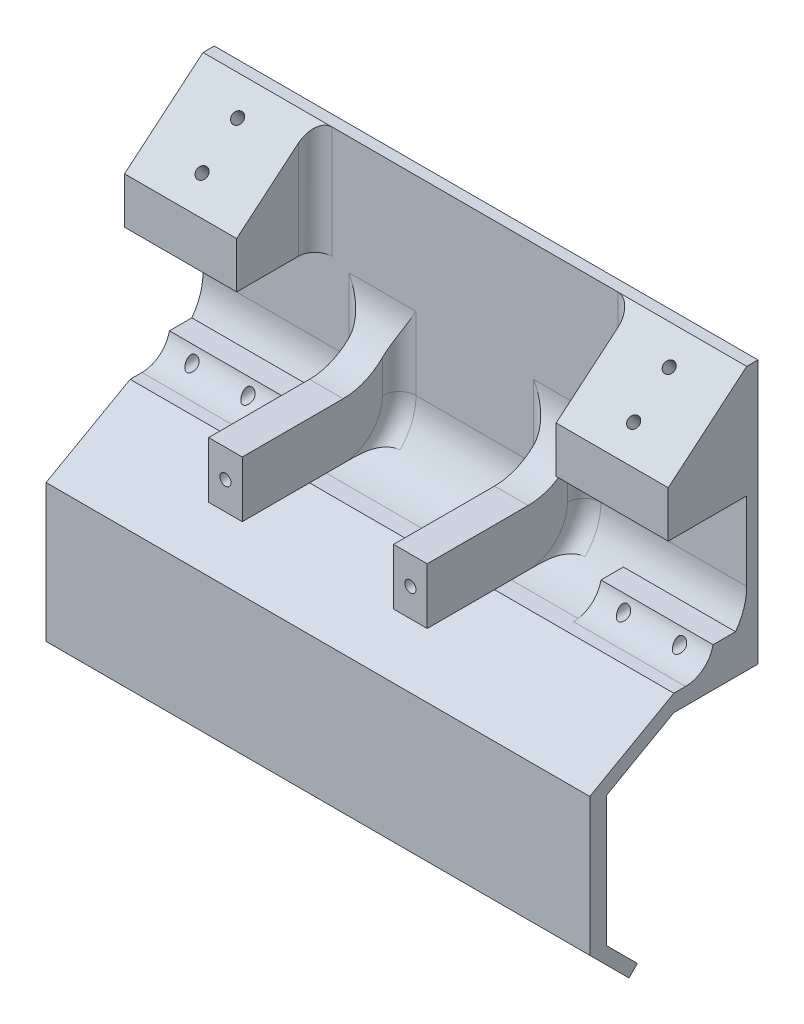
from build123d import *

# Parameters (mm, degrees)
SKETCH1_W            = 97
SKETCH1_H            = 47
BOSS_EXTRUDE1_DEPTH  = 2
SKETCH2_W            = 97
SKETCH2_H            = 20
BOSS_EXTRUDE2_DEPTH  = 20
CUT_EXTRUDE1_DEPTH   = 131
BOSS_EXTRUDE3_DEPTH  = 97
SKETCH6_W            = 57
SKETCH6_H            = 28.630146457
CUT_EXTRUDE3_DEPTH   = 82
SKETCH7_R            = 1
CUT_EXTRUDE4_DEPTH   = 82
SKETCH8_W            = 18.73898083
SKETCH8_H            = 25.042097397
CUT_EXTRUDE5_DEPTH   = 136
SKETCH9_R            = 1
CUT_EXTRUDE6_DEPTH   = 6
SKETCH11_W           = 97
SKETCH11_H           = 3
BOSS_EXTRUDE4_DEPTH  = 13
BOSS_EXTRUDE5_DEPTH  = 97
SKETCH13_W           = 3
SKETCH13_H           = 23.243678218
BOSS_EXTRUDE6_DEPTH  = 97
CUT_EXTRUDE7_START   = -97
SKETCH14_W           = 4.818553825
SKETCH14_H           = 10.461709092
CUT_EXTRUDE7_DEPTH   = 97
BOSS_EXTRUDE8_DEPTH  = 97
SKETCH16_W           = 6
SKETCH16_H           = 10
BOSS_EXTRUDE9_DEPTH  = 28
SKETCH17_R           = 1
CUT_EXTRUDE8_DEPTH   = 8
BOSS_EXTRUDE10_START = 6
SKETCH18_W           = 20
SKETCH18_H           = 4
SKETCH18_R           = 1
BOSS_EXTRUDE10_DEPTH = 6
FILLET1_R            = 5
FILLET2_R            = 10
FILLET3_R            = 3
FILLET4_R            = 3
FILLET5_R            = 3


# Some blends are built 0.0001 mm under size
with BuildPart() as part:
    # Sketch1 → Boss-Extrude1 (new body)
    with BuildSketch(Plane.XY):
        with Locations((48.5, 23.5)):
            Rectangle(SKETCH1_W, SKETCH1_H)
    extrude(amount=BOSS_EXTRUDE1_DEPTH)

    # Sketch2 → Boss-Extrude2 (add)
    with BuildSketch(Plane.XY.offset(2)):
        with Locations((48.5, 37)):
            Rectangle(SKETCH2_W, SKETCH2_H)
    extrude(amount=BOSS_EXTRUDE2_DEPTH)

    # Sketch3 → Cut-Extrude1 (cut)
    with BuildSketch(Plane.ZY):
        Polygon((2, 47), (24.809031761, 27.860949862), (24.941765114, 51.599681625), align=None)
    extrude(amount=-CUT_EXTRUDE1_DEPTH, mode=Mode.SUBTRACT)

    # Sketch4 → Boss-Extrude3 (add)
    with BuildSketch(Plane.ZY):
        Polygon((19.047930723, 32.695087618), (21.145957589, 30.934634049), (25.835071852, 27), (20.096944156, 27), align=None)
    extrude(amount=-BOSS_EXTRUDE3_DEPTH)

    # Sketch6 → Cut-Extrude3 (cut)
    with BuildSketch(Plane.XY.offset(2)):
        with Locations((48.5, 32.684926772)):
            Rectangle(SKETCH6_W, SKETCH6_H)
    extrude(amount=CUT_EXTRUDE3_DEPTH, mode=Mode.SUBTRACT)

    # Sketch7 → Cut-Extrude4 (cut)
    with BuildSketch(Plane.XY.offset(2)):
        with Locations(Location((15, 5, 0), (0, 0, 180))):
            Circle(SKETCH7_R)
        with Locations(Location((5, 5, 0), (0, 0, 180))):
            Circle(SKETCH7_R)
        with Locations((92, 5)):
            Circle(SKETCH7_R)
        with Locations((82, 5)):
            Circle(SKETCH7_R)
    extrude(amount=-CUT_EXTRUDE4_DEPTH, mode=Mode.SUBTRACT)

    # Sketch8 → Cut-Extrude5 (cut)
    with BuildSketch(Plane.ZY):
        with Locations((25.369490415, 39.521048699)):
            Rectangle(SKETCH8_W, SKETCH8_H)
    extrude(amount=-CUT_EXTRUDE5_DEPTH, mode=Mode.SUBTRACT)

    # Sketch9 → Cut-Extrude6 (cut)
    with BuildSketch(Plane(origin=(0, 28.565539928, 23.969334018), x_dir=(1, 0, 0), z_dir=(0, 0.7660444431189791, 0.642787609686538))):
        with Locations(Location((10, 23.678928769, 0), (0, 0, 270))):
            Circle(SKETCH9_R)
        with Locations(Location((10, 15.403226718, 0), (0, 0, 270))):
            Circle(SKETCH9_R)
        with Locations(Location((87, 15.403226718, 0), (0, 0, 270))):
            Circle(SKETCH9_R)
        with Locations(Location((87, 23.678928769, 0), (0, 0, 270))):
            Circle(SKETCH9_R)
    extrude(amount=-CUT_EXTRUDE6_DEPTH, mode=Mode.SUBTRACT)

    # Sketch11 → Boss-Extrude4 (add)
    with BuildSketch(Plane.XY.offset(2)):
        with Locations((48.5, 1.5)):
            Rectangle(SKETCH11_W, SKETCH11_H)
    extrude(amount=BOSS_EXTRUDE4_DEPTH)

    # Sketch12 → Boss-Extrude5 (add)
    with BuildSketch(Plane.ZY):
        Polygon((15, 0), (27, -6.756321782), (32.328343019, -6.756321782), (15, 3), align=None)
    extrude(amount=-BOSS_EXTRUDE5_DEPTH)

    # Sketch13 → Boss-Extrude6 (add)
    with BuildSketch(Plane.ZY):
        with Locations((28.5, -18.378160891)):
            Rectangle(SKETCH13_W, SKETCH13_H)
    extrude(amount=-BOSS_EXTRUDE6_DEPTH)

    # Sketch14 → Cut-Extrude7 (cut)
    with BuildSketch(Plane.ZY.offset(CUT_EXTRUDE7_START)):
        with Locations((32.409276913, -6.226488052)):
            Rectangle(SKETCH14_W, SKETCH14_H)
    extrude(amount=CUT_EXTRUDE7_DEPTH, mode=Mode.SUBTRACT)

    # Sketch15 → Boss-Extrude8 (add)
    with BuildSketch(Plane.ZY):
        Polygon((21.5, -35.5), (27, -30), (30, -30), (23, -37), align=None)
    extrude(amount=-BOSS_EXTRUDE8_DEPTH)

    # Sketch16 → Boss-Extrude9 (add)
    with BuildSketch(Plane.XY.offset(2)):
        with Locations((32, 11)):
            Rectangle(SKETCH16_W, SKETCH16_H)
        with Locations((65, 11)):
            Rectangle(SKETCH16_W, SKETCH16_H)
    extrude(amount=BOSS_EXTRUDE9_DEPTH)

    # Sketch17 → Cut-Extrude8 (cut)
    with BuildSketch(Plane.XY.offset(30)):
        with Locations((32, 11)):
            Circle(SKETCH17_R)
        with Locations((65, 11)):
            Circle(SKETCH17_R)
    extrude(amount=-CUT_EXTRUDE8_DEPTH, mode=Mode.SUBTRACT)

    # Sketch18 → Boss-Extrude10 (add)
    # profile 1 of 2: a face of its own
    with BuildSketch(Plane.XY.offset(2).offset(BOSS_EXTRUDE10_START)):
        with Locations((10, 5)):
            Rectangle(SKETCH18_W, SKETCH18_H)
        with Locations((5, 5)):
            Circle(SKETCH18_R, mode=Mode.SUBTRACT)
        with Locations((15, 5)):
            Circle(SKETCH18_R, mode=Mode.SUBTRACT)
    # profile 2 of 2: a face of its own
    with BuildSketch(Plane.XY.offset(2).offset(BOSS_EXTRUDE10_START)):
        with Locations((87, 5)):
            Rectangle(SKETCH18_W, SKETCH18_H)
        with Locations((82, 5)):
            Circle(SKETCH18_R, mode=Mode.SUBTRACT)
        with Locations((92, 5)):
            Circle(SKETCH18_R, mode=Mode.SUBTRACT)
    extrude(amount=-BOSS_EXTRUDE10_DEPTH)

    # Fillet1
    # the kernel refuses this fillet: 5 mm, written as the material it adds along each edge
    with BuildSketch(Plane(origin=(77, 3, 8), x_dir=(0, 1.0, 1.5658585539308206e-12), z_dir=(1, 0, 0))) as fillet1_piece_1_section:
        with BuildLine():
            CenterArc((5, 4.898979486), FILLET1_R, 180, 78.463040967)
            Line((0, 4.898979486), (0, 0))
            Line((0, 0), (4, 0))
        make_face()
    fillet1_piece_1 = extrude(amount=20, mode=Mode.PRIVATE)
    fillet1_piece_1 = fillet1_piece_1 - Plane(origin=(92, 5, 8.122373688), x_dir=(1, 0, 0), z_dir=(0, 0, 1)) * Cylinder(1, 60, mode=Mode.PRIVATE)
    fillet1_piece_1 = fillet1_piece_1 - Plane(origin=(82, 5, 8.122373688), x_dir=(1, 0, 0), z_dir=(0, 0, 1)) * Cylinder(1, 60, mode=Mode.PRIVATE)
    add(fillet1_piece_1)
    with BuildSketch(Plane(origin=(0, 3, 8), x_dir=(0, 1.0, 1.5658585539308206e-12), z_dir=(1, 0, 0))) as fillet1_piece_2_section:
        with BuildLine():
            CenterArc((5, 4.898979486), FILLET1_R, 180, 78.463040967)
            Line((0, 4.898979486), (0, 0))
            Line((0, 0), (4, 0))
        make_face()
    fillet1_piece_2 = extrude(amount=20, mode=Mode.PRIVATE)
    fillet1_piece_2 = fillet1_piece_2 - Plane(origin=(15, 5, 8.122373688), x_dir=(-1, 0, 0), z_dir=(0, 0, 1)) * Cylinder(1, 60, mode=Mode.PRIVATE)
    fillet1_piece_2 = fillet1_piece_2 - Plane(origin=(5, 5, 8.122373688), x_dir=(-1, 0, 0), z_dir=(0, 0, 1)) * Cylinder(1, 60, mode=Mode.PRIVATE)
    add(fillet1_piece_2)

    # Fillet2
    # the kernel refuses this fillet: 10 mm, written as the material it adds along each edge
    with BuildSketch(Plane(origin=(102, 3, 2), x_dir=(0, 1, 0), z_dir=(-1, 0, 0))) as fillet2_piece_1_section:
        with BuildLine():
            CenterArc((FILLET2_R, -FILLET2_R), FILLET2_R, 90, 90)
            Line((0, -FILLET2_R), (0, 0))
            Line((0, 0), (FILLET2_R, 0))
        make_face()
    fillet2_piece_1 = extrude(amount=107, mode=Mode.PRIVATE)
    fillet2_piece_1 = fillet2_piece_1 - Plane(origin=(5, 5, 2.588098878), x_dir=(-1, 0, 0), z_dir=(0, 0, 1)) * Cylinder(1, 254, mode=Mode.PRIVATE)
    fillet2_piece_1 = fillet2_piece_1 - Plane(origin=(92, 5, 2.588098878), x_dir=(1, 0, 0), z_dir=(0, 0, 1)) * Cylinder(1, 254, mode=Mode.PRIVATE)
    fillet2_piece_1 = fillet2_piece_1 - Plane(origin=(82, 5, 2.588098878), x_dir=(1, 0, 0), z_dir=(0, 0, 1)) * Cylinder(1, 254, mode=Mode.PRIVATE)
    fillet2_piece_1 = fillet2_piece_1 - Plane(origin=(15, 5, 2.588098878), x_dir=(-1, 0, 0), z_dir=(0, 0, 1)) * Cylinder(1, 254, mode=Mode.PRIVATE)
    fillet2_piece_1 = split(fillet2_piece_1, bisect_by=Plane(origin=(97, 8.468343904, 2.588098878), z_dir=(-1, 0, 0)), keep=Keep.TOP, mode=Mode.PRIVATE)
    fillet2_piece_1 = split(fillet2_piece_1, bisect_by=Plane(origin=(0, 8.468343904, 2.588098878), z_dir=(1, 0, 0)), keep=Keep.TOP, mode=Mode.PRIVATE)
    add(fillet2_piece_1)
    with BuildSketch(Plane(origin=(68, 16, 2), x_dir=(0, 1, 0), z_dir=(-1, 0, 0))) as fillet2_piece_2:
        with BuildLine():
            CenterArc((FILLET2_R, -FILLET2_R), FILLET2_R, 90, 90)
            Line((0, -FILLET2_R), (0, 0))
            Line((0, 0), (FILLET2_R, 0))
        make_face()
    extrude(amount=6)
    with BuildSketch(Plane(origin=(29, 16, 2), x_dir=(0, 1, 0), z_dir=(1, 0, 0))) as fillet2_piece_3:
        with BuildLine():
            CenterArc((FILLET2_R, FILLET2_R), FILLET2_R, 180, 90)
            Line((0, FILLET2_R), (0, 0))
            Line((0, 0), (FILLET2_R, 0))
        make_face()
    extrude(amount=6)

    # Fillet3
    fillet3_edges = [part.edges().sort_by_distance(p)[0] for p in [
        (35, 19.5, 2),
        (62, 19.5, 2),
        (35, 9.219410382, 2.742184807),
        (62, 9.219410382, 2.742184807),
    ]]
    fillet(fillet3_edges, radius=FILLET3_R - 0.0001)  # a hair under: the kernel refuses the full size

    # Fillet4
    fillet4_edges = [part.edges().sort_by_distance(p)[0] for p in [
        (29, 19.5, 2),
        (68, 19.5, 2),
        (29, 9.219410382, 2.742184807),
        (68, 9.219410382, 2.742184807),
    ]]
    fillet(fillet4_edges, radius=FILLET4_R - 0.0001)  # a hair under: the kernel refuses the full size

    # Fillet5
    fillet5_edges = [part.edges().sort_by_distance(p)[0] for p in [
        (20, 37, 2),
        (77, 37, 2),
    ]]
    fillet(fillet5_edges, radius=FILLET5_R)


solid = part.part
